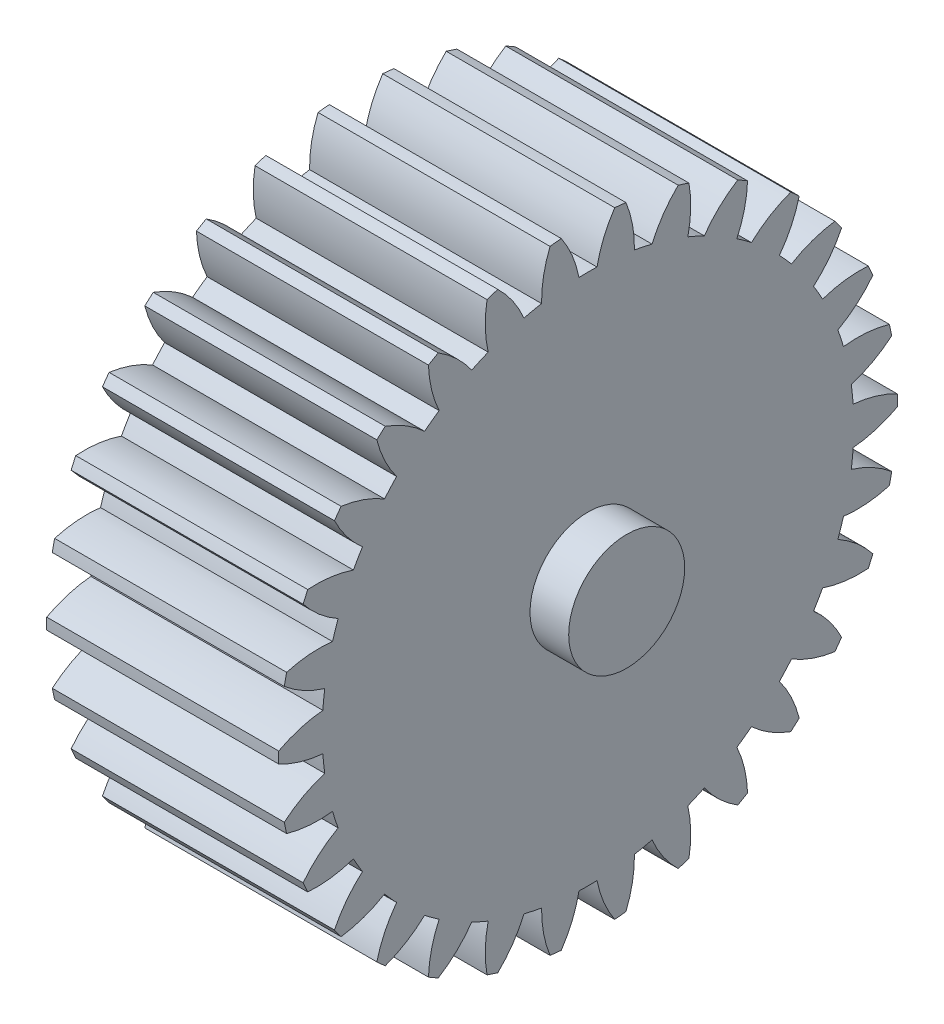
from build123d import *

# Parameters (mm, degrees)
SPUR_GEAR_GB_BORE_OUTLINE_R = 1
SPUR_GEAR_GB_BORE_DEPTH     = 6
SKETCH_2_R                  = 1.5
EXTRUDE_1_DEPTH             = 1


# Read off the part's stored shape, not the designer's step: <spur gear_gb>-<Bore>
with BuildPart() as part:
    # <spur gear_gb>-<Bore> outline → <spur gear_gb>-<Bore> (new body)
    with BuildSketch(Plane.YZ):
        with BuildLine():
            ThreePointArc((0.146326846, 7.998661666), (0, 8), (-0.146326846, 7.998661666))
            ThreePointArc((-0.146326846, 7.998661666), (-0.373564224, 7.444765892), (-0.486289788, 6.856777541))
            ThreePointArc((-0.486289788, 6.856777541), (-0.718528657, 6.836343509), (-0.949941023, 6.808045832))
            ThreePointArc((-0.949941023, 6.808045832), (-1.182452915, 7.359748265), (-1.519886018, 7.85429478))
            ThreePointArc((-1.519886018, 7.85429478), (-1.663293526, 7.825180806), (-1.806144524, 7.793448656))
            ThreePointArc((-1.806144524, 7.793448656), (-1.913254814, 7.204411526), (-1.901267401, 6.605835168))
            ThreePointArc((-1.901267401, 6.605835168), (-2.124182819, 6.537562493), (-2.344654853, 6.461769852))
            ThreePointArc((-2.344654853, 6.461769852), (-2.686791187, 6.953074323), (-3.11967257, 7.366657523))
            ThreePointArc((-3.11967257, 7.366657523), (-3.253893145, 7.308363661), (-3.387025021, 7.247624543))
            ThreePointArc((-3.387025021, 7.247624543), (-3.369326988, 6.649189806), (-3.233150506, 6.066186101))
            ThreePointArc((-3.233150506, 6.066186101), (-3.437, 5.953058626), (-3.636896014, 5.833083523))
            ThreePointArc((-3.636896014, 5.833083523), (-4.073703792, 6.242517668), (-4.583114461, 6.557061982))
            ThreePointArc((-4.583114461, 6.557061982), (-4.702282019, 6.472135955), (-4.819876271, 6.385044458))
            ThreePointArc((-4.819876271, 6.385044458), (-4.678143404, 5.803366584), (-4.423729419, 5.261415592))
            ThreePointArc((-4.423729419, 5.261415592), (-4.599603788, 5.10837753), (-4.770187368, 4.949463453))
            ThreePointArc((-4.770187368, 4.949463453), (-5.282575994, 5.259133036), (-5.846252257, 5.460891369))
            ThreePointArc((-5.846252257, 5.460891369), (-5.945158604, 5.353044851), (-6.042075799, 5.243407293))
            ThreePointArc((-6.042075799, 5.243407293), (-5.782502506, 4.703908396), (-5.420970129, 4.226695974))
            ThreePointArc((-5.420970129, 4.226695974), (-5.561182819, 4.040435824), (-5.694998644, 3.84952808))
            ThreePointArc((-5.694998644, 3.84952808), (-6.260574276, 4.045899054), (-6.853880777, 4.126053599))
            ThreePointArc((-6.853880777, 4.126053599), (-6.92820323, 4), (-7.000207622, 3.872608067))
            ThreePointArc((-7.000207622, 3.872608067), (-6.6341385, 3.398866838), (-6.181288432, 3.007249461))
            ThreePointArc((-6.181288432, 3.007249461), (-6.279711476, 2.795907685), (-6.370911152, 2.581349858))
            ThreePointArc((-6.370911152, 2.581349858), (-6.96495542, 2.65583987), (-7.561961817, 2.610887487))
            ThreePointArc((-7.561961817, 2.610887487), (-7.60845213, 2.472135955), (-7.652396782, 2.332557287))
            ThreePointArc((-7.652396782, 2.332557287), (-7.195830808, 1.94527849), (-6.671454769, 1.656371715))
            ThreePointArc((-6.671454769, 1.656371715), (-6.723786607, 1.429184963), (-6.768384272, 1.200354261))
            ThreePointArc((-6.768384272, 1.200354261), (-7.364934592, 1.149707739), (-7.939548841, 0.981613064))
            ThreePointArc((-7.939548841, 0.981613064), (-7.956175163, 0.836227706), (-7.970139481, 0.69056256))
            ThreePointArc((-7.970139481, 0.69056256), (-7.44303078, 0.406672138), (-6.87004652, 0.233102578))
            ThreePointArc((-6.87004652, 0.233102578), (-6.874, 0), (-6.87004652, -0.233102578))
            ThreePointArc((-6.87004652, -0.233102578), (-7.44303078, -0.406672138), (-7.970139481, -0.69056256))
            ThreePointArc((-7.970139481, -0.69056256), (-7.956175163, -0.836227706), (-7.939548841, -0.981613064))
            ThreePointArc((-7.939548841, -0.981613064), (-7.364934592, -1.149707739), (-6.768384272, -1.200354261))
            ThreePointArc((-6.768384272, -1.200354261), (-6.723786607, -1.429184963), (-6.671454769, -1.656371715))
            ThreePointArc((-6.671454769, -1.656371715), (-7.195830808, -1.94527849), (-7.652396782, -2.332557287))
            ThreePointArc((-7.652396782, -2.332557287), (-7.60845213, -2.472135955), (-7.561961817, -2.610887487))
            ThreePointArc((-7.561961817, -2.610887487), (-6.96495542, -2.65583987), (-6.370911152, -2.581349858))
            ThreePointArc((-6.370911152, -2.581349858), (-6.279711476, -2.795907685), (-6.181288432, -3.007249461))
            ThreePointArc((-6.181288432, -3.007249461), (-6.6341385, -3.398866838), (-7.000207622, -3.872608067))
            ThreePointArc((-7.000207622, -3.872608067), (-6.92820323, -4), (-6.853880777, -4.126053599))
            ThreePointArc((-6.853880777, -4.126053599), (-6.260574276, -4.045899054), (-5.694998644, -3.84952808))
            ThreePointArc((-5.694998644, -3.84952808), (-5.561182819, -4.040435824), (-5.420970129, -4.226695974))
            ThreePointArc((-5.420970129, -4.226695974), (-5.782502506, -4.703908396), (-6.042075799, -5.243407293))
            ThreePointArc((-6.042075799, -5.243407293), (-5.945158604, -5.353044851), (-5.846252257, -5.460891369))
            ThreePointArc((-5.846252257, -5.460891369), (-5.282575994, -5.259133036), (-4.770187368, -4.949463453))
            ThreePointArc((-4.770187368, -4.949463453), (-4.599603788, -5.10837753), (-4.423729419, -5.261415592))
            ThreePointArc((-4.423729419, -5.261415592), (-4.678143404, -5.803366584), (-4.819876271, -6.385044458))
            ThreePointArc((-4.819876271, -6.385044458), (-4.702282019, -6.472135955), (-4.583114461, -6.557061982))
            ThreePointArc((-4.583114461, -6.557061982), (-4.073703792, -6.242517668), (-3.636896014, -5.833083523))
            ThreePointArc((-3.636896014, -5.833083523), (-3.437, -5.953058626), (-3.233150506, -6.066186101))
            ThreePointArc((-3.233150506, -6.066186101), (-3.369326988, -6.649189806), (-3.387025021, -7.247624543))
            ThreePointArc((-3.387025021, -7.247624543), (-3.253893145, -7.308363661), (-3.11967257, -7.366657523))
            ThreePointArc((-3.11967257, -7.366657523), (-2.686791187, -6.953074323), (-2.344654853, -6.461769852))
            ThreePointArc((-2.344654853, -6.461769852), (-2.124182819, -6.537562493), (-1.901267401, -6.605835168))
            ThreePointArc((-1.901267401, -6.605835168), (-1.913254814, -7.204411526), (-1.806144524, -7.793448656))
            ThreePointArc((-1.806144524, -7.793448656), (-1.663293526, -7.825180806), (-1.519886018, -7.85429478))
            ThreePointArc((-1.519886018, -7.85429478), (-1.182452915, -7.359748265), (-0.949941023, -6.808045832))
            ThreePointArc((-0.949941023, -6.808045832), (-0.718528657, -6.836343509), (-0.486289788, -6.856777541))
            ThreePointArc((-0.486289788, -6.856777541), (-0.373564224, -7.444765892), (-0.146326846, -7.998661666))
            ThreePointArc((-0.146326846, -7.998661666), (0, -8), (0.146326846, -7.998661666))
            ThreePointArc((0.146326846, -7.998661666), (0.373564224, -7.444765892), (0.486289788, -6.856777541))
            ThreePointArc((0.486289788, -6.856777541), (0.718528657, -6.836343509), (0.949941023, -6.808045832))
            ThreePointArc((0.949941023, -6.808045832), (1.182452915, -7.359748265), (1.519886018, -7.85429478))
            ThreePointArc((1.519886018, -7.85429478), (1.663293526, -7.825180806), (1.806144524, -7.793448656))
            ThreePointArc((1.806144524, -7.793448656), (1.913254814, -7.204411526), (1.901267401, -6.605835168))
            ThreePointArc((1.901267401, -6.605835168), (2.124182819, -6.537562493), (2.344654853, -6.461769852))
            ThreePointArc((2.344654853, -6.461769852), (2.686791187, -6.953074323), (3.11967257, -7.366657523))
            ThreePointArc((3.11967257, -7.366657523), (3.253893145, -7.308363661), (3.387025021, -7.247624543))
            ThreePointArc((3.387025021, -7.247624543), (3.369326988, -6.649189806), (3.233150506, -6.066186101))
            ThreePointArc((3.233150506, -6.066186101), (3.437, -5.953058626), (3.636896014, -5.833083523))
            ThreePointArc((3.636896014, -5.833083523), (4.073703792, -6.242517668), (4.583114461, -6.557061982))
            ThreePointArc((4.583114461, -6.557061982), (4.702282019, -6.472135955), (4.819876271, -6.385044458))
            ThreePointArc((4.819876271, -6.385044458), (4.678143404, -5.803366584), (4.423729419, -5.261415592))
            ThreePointArc((4.423729419, -5.261415592), (4.599603788, -5.10837753), (4.770187368, -4.949463453))
            ThreePointArc((4.770187368, -4.949463453), (5.282575994, -5.259133036), (5.846252257, -5.460891369))
            ThreePointArc((5.846252257, -5.460891369), (5.945158604, -5.353044851), (6.042075799, -5.243407293))
            ThreePointArc((6.042075799, -5.243407293), (5.782502506, -4.703908396), (5.420970129, -4.226695974))
            ThreePointArc((5.420970129, -4.226695974), (5.561182819, -4.040435824), (5.694998644, -3.84952808))
            ThreePointArc((5.694998644, -3.84952808), (6.260574276, -4.045899054), (6.853880777, -4.126053599))
            ThreePointArc((6.853880777, -4.126053599), (6.92820323, -4), (7.000207622, -3.872608067))
            ThreePointArc((7.000207622, -3.872608067), (6.6341385, -3.398866838), (6.181288432, -3.007249461))
            ThreePointArc((6.181288432, -3.007249461), (6.279711476, -2.795907685), (6.370911152, -2.581349858))
            ThreePointArc((6.370911152, -2.581349858), (6.96495542, -2.65583987), (7.561961817, -2.610887487))
            ThreePointArc((7.561961817, -2.610887487), (7.60845213, -2.472135955), (7.652396782, -2.332557287))
            ThreePointArc((7.652396782, -2.332557287), (7.195830808, -1.94527849), (6.671454769, -1.656371715))
            ThreePointArc((6.671454769, -1.656371715), (6.723786607, -1.429184963), (6.768384272, -1.200354261))
            ThreePointArc((6.768384272, -1.200354261), (7.364934592, -1.149707739), (7.939548841, -0.981613064))
            ThreePointArc((7.939548841, -0.981613064), (7.956175163, -0.836227706), (7.970139481, -0.69056256))
            ThreePointArc((7.970139481, -0.69056256), (7.44303078, -0.406672138), (6.87004652, -0.233102578))
            ThreePointArc((6.87004652, -0.233102578), (6.874, 0), (6.87004652, 0.233102578))
            ThreePointArc((6.87004652, 0.233102578), (7.44303078, 0.406672138), (7.970139481, 0.69056256))
            ThreePointArc((7.970139481, 0.69056256), (7.956175163, 0.836227706), (7.939548841, 0.981613064))
            ThreePointArc((7.939548841, 0.981613064), (7.364934592, 1.149707739), (6.768384272, 1.200354261))
            ThreePointArc((6.768384272, 1.200354261), (6.723786607, 1.429184963), (6.671454769, 1.656371715))
            ThreePointArc((6.671454769, 1.656371715), (7.195830808, 1.94527849), (7.652396782, 2.332557287))
            ThreePointArc((7.652396782, 2.332557287), (7.60845213, 2.472135955), (7.561961817, 2.610887487))
            ThreePointArc((7.561961817, 2.610887487), (6.96495542, 2.65583987), (6.370911152, 2.581349858))
            ThreePointArc((6.370911152, 2.581349858), (6.279711476, 2.795907685), (6.181288432, 3.007249461))
            ThreePointArc((6.181288432, 3.007249461), (6.6341385, 3.398866838), (7.000207622, 3.872608067))
            ThreePointArc((7.000207622, 3.872608067), (6.92820323, 4), (6.853880777, 4.126053599))
            ThreePointArc((6.853880777, 4.126053599), (6.260574276, 4.045899054), (5.694998644, 3.84952808))
            ThreePointArc((5.694998644, 3.84952808), (5.561182819, 4.040435824), (5.420970129, 4.226695974))
            ThreePointArc((5.420970129, 4.226695974), (5.782502506, 4.703908396), (6.042075799, 5.243407293))
            ThreePointArc((6.042075799, 5.243407293), (5.945158604, 5.353044851), (5.846252257, 5.460891369))
            ThreePointArc((5.846252257, 5.460891369), (5.282575994, 5.259133036), (4.770187368, 4.949463453))
            ThreePointArc((4.770187368, 4.949463453), (4.599603788, 5.10837753), (4.423729419, 5.261415592))
            ThreePointArc((4.423729419, 5.261415592), (4.678143404, 5.803366584), (4.819876271, 6.385044458))
            ThreePointArc((4.819876271, 6.385044458), (4.702282019, 6.472135955), (4.583114461, 6.557061982))
            ThreePointArc((4.583114461, 6.557061982), (4.073703792, 6.242517668), (3.636896014, 5.833083523))
            ThreePointArc((3.636896014, 5.833083523), (3.437, 5.953058626), (3.233150506, 6.066186101))
            ThreePointArc((3.233150506, 6.066186101), (3.369326988, 6.649189806), (3.387025021, 7.247624543))
            ThreePointArc((3.387025021, 7.247624543), (3.253893145, 7.308363661), (3.11967257, 7.366657523))
            ThreePointArc((3.11967257, 7.366657523), (2.686791187, 6.953074323), (2.344654853, 6.461769852))
            ThreePointArc((2.344654853, 6.461769852), (2.124182819, 6.537562493), (1.901267401, 6.605835168))
            ThreePointArc((1.901267401, 6.605835168), (1.913254814, 7.204411526), (1.806144524, 7.793448656))
            ThreePointArc((1.806144524, 7.793448656), (1.663293526, 7.825180806), (1.519886018, 7.85429478))
            ThreePointArc((1.519886018, 7.85429478), (1.182452915, 7.359748265), (0.949941023, 6.808045832))
            ThreePointArc((0.949941023, 6.808045832), (0.718528657, 6.836343509), (0.486289788, 6.856777541))
            ThreePointArc((0.486289788, 6.856777541), (0.373564224, 7.444765892), (0.146326846, 7.998661666))
        make_face()
        Circle(SPUR_GEAR_GB_BORE_OUTLINE_R, mode=Mode.SUBTRACT)
    extrude(amount=SPUR_GEAR_GB_BORE_DEPTH)

    # 草图2 → 凸台-拉伸1 (add)
    with BuildSketch(Plane(origin=(6, 0, 0), x_dir=(0, 0, -1), z_dir=(1, 0, 0))):
        with Locations(Location((0, 0, 0), (0, 0, 180))):
            Circle(SKETCH_2_R)
    extrude(amount=EXTRUDE_1_DEPTH)


solid = part.part
